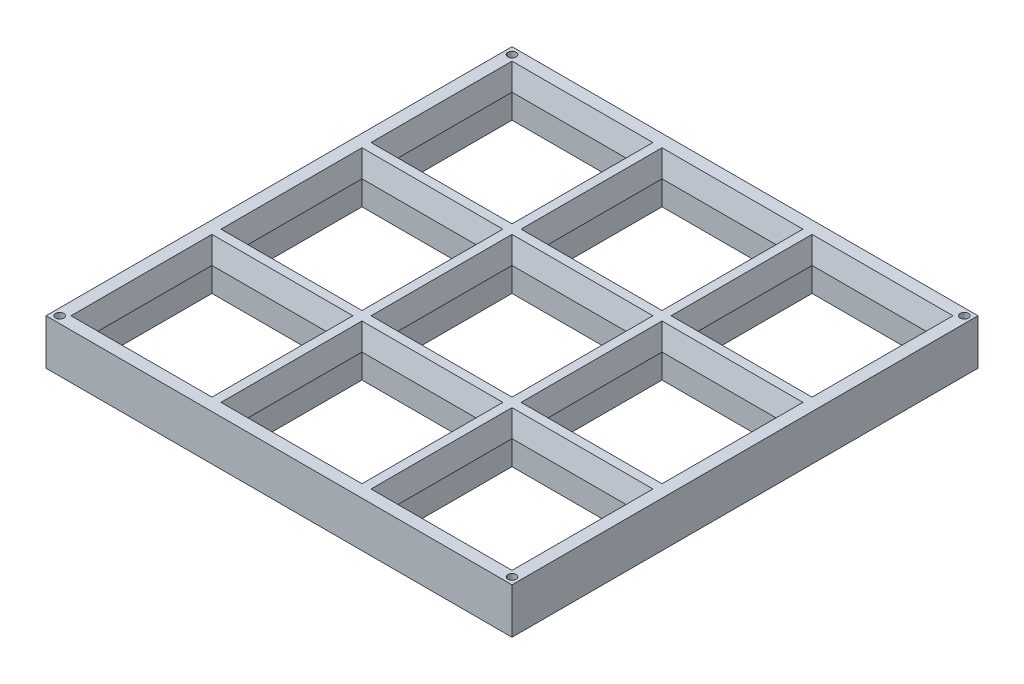
from build123d import *

# Parameters (mm, degrees)
SKETCH2_W                    = 205
SKETCH2_H                    = 205
BOSS_EXTRUDE1_DEPTH          = 20
SKETCH3_W                    = 57
SKETCH3_H                    = 57
CUT_EXTRUDE1_DEPTH           = 147.330106267
LPATTERN1_COUNT              = 3
LPATTERN1_PITCH              = 66
LPATTERN1_COUNT_DIR2         = 3
LPATTERN1_PITCH_DIR2         = 66
CHAMFER1_SIZE                = 2.5
CHAMFER1_SIZE2               = 9.330127019
M3_CLEARANCE_HOLE1_OUTLINE_R = 1.8
M3_CLEARANCE_HOLE1_DEPTH     = 20


# Read off the part's stored shape, not the designer's step: M3 Clearance Hole1
with BuildPart() as part:
    # Sketch2 → Boss-Extrude1 (new body)
    with BuildSketch(Plane(origin=(0, 0, 0), x_dir=(1, 0, 0), z_dir=(0, 1, 0))):
        Rectangle(SKETCH2_W, SKETCH2_H)
    extrude(amount=BOSS_EXTRUDE1_DEPTH)

    # Sketch3 → Cut-Extrude1 (cut, through all)
    with BuildSketch(Plane(origin=(0, 20, 0), x_dir=(1, 0, 0), z_dir=(0, 1, 0))):
        with Locations((-66, 66)):
            Rectangle(SKETCH3_W, SKETCH3_H)
    cut_extrude1 = extrude(amount=-CUT_EXTRUDE1_DEPTH, mode=Mode.SUBTRACT)

    # LPattern1: Cut-Extrude1 3 × 3
    with Locations(*[(i * LPATTERN1_PITCH, 0, j * LPATTERN1_PITCH_DIR2) for i in range(LPATTERN1_COUNT) for j in range(LPATTERN1_COUNT_DIR2) if (i, j) != (0, 0)]):
        add(cut_extrude1, mode=Mode.SUBTRACT)

    # Chamfer1
    chamfer1_edges = [part.edges().sort_by_distance(p)[0] for p in [
        (94.5, 20, 66),
        (66, 20, 94.5),
        (37.5, 20, 66),
        (66, 20, 37.5),
        (-37.5, 20, -66),
        (-66, 20, -94.5),
        (-94.5, 20, -66),
        (-66, 20, -37.5),
        (28.5, 20, -66),
        (0, 20, -94.5),
        (-28.5, 20, -66),
        (0, 20, -37.5),
        (94.5, 20, -66),
        (66, 20, -37.5),
        (37.5, 20, -66),
        (66, 20, -94.5),
        (-37.5, 20, 0),
        (-66, 20, 28.5),
        (-94.5, 20, 0),
        (-66, 20, -28.5),
        (28.5, 20, 0),
        (0, 20, 28.5),
        (-28.5, 20, 0),
        (0, 20, -28.5),
        (94.5, 20, 0),
        (66, 20, 28.5),
        (37.5, 20, 0),
        (66, 20, -28.5),
        (-37.5, 20, 66),
        (-66, 20, 94.5),
        (-94.5, 20, 66),
        (-66, 20, 37.5),
        (28.5, 20, 66),
        (0, 20, 94.5),
        (-28.5, 20, 66),
        (0, 20, 37.5),
    ]]
    chamfer1_side = [part.faces().sort_by_distance(p)[0] for p in [
        (0, 20, 99.600862197),
    ]]
    chamfer(chamfer1_edges, length=CHAMFER1_SIZE, length2=CHAMFER1_SIZE2, reference=chamfer1_side[0])

    # M3 Clearance Hole1 outline → M3 Clearance Hole1 (cut)
    with BuildSketch(Plane(origin=(0, 0, 0), x_dir=(1, 0, 0), z_dir=(0, 1, 0))):
        with Locations((-99.5, -99.5)):
            Circle(M3_CLEARANCE_HOLE1_OUTLINE_R)
        with Locations((99.5, 99.5)):
            Circle(M3_CLEARANCE_HOLE1_OUTLINE_R)
        with Locations((99.5, -99.5)):
            Circle(M3_CLEARANCE_HOLE1_OUTLINE_R)
        with Locations((-99.5, 99.5)):
            Circle(M3_CLEARANCE_HOLE1_OUTLINE_R)
    extrude(amount=M3_CLEARANCE_HOLE1_DEPTH, mode=Mode.SUBTRACT)


solid = part.part
